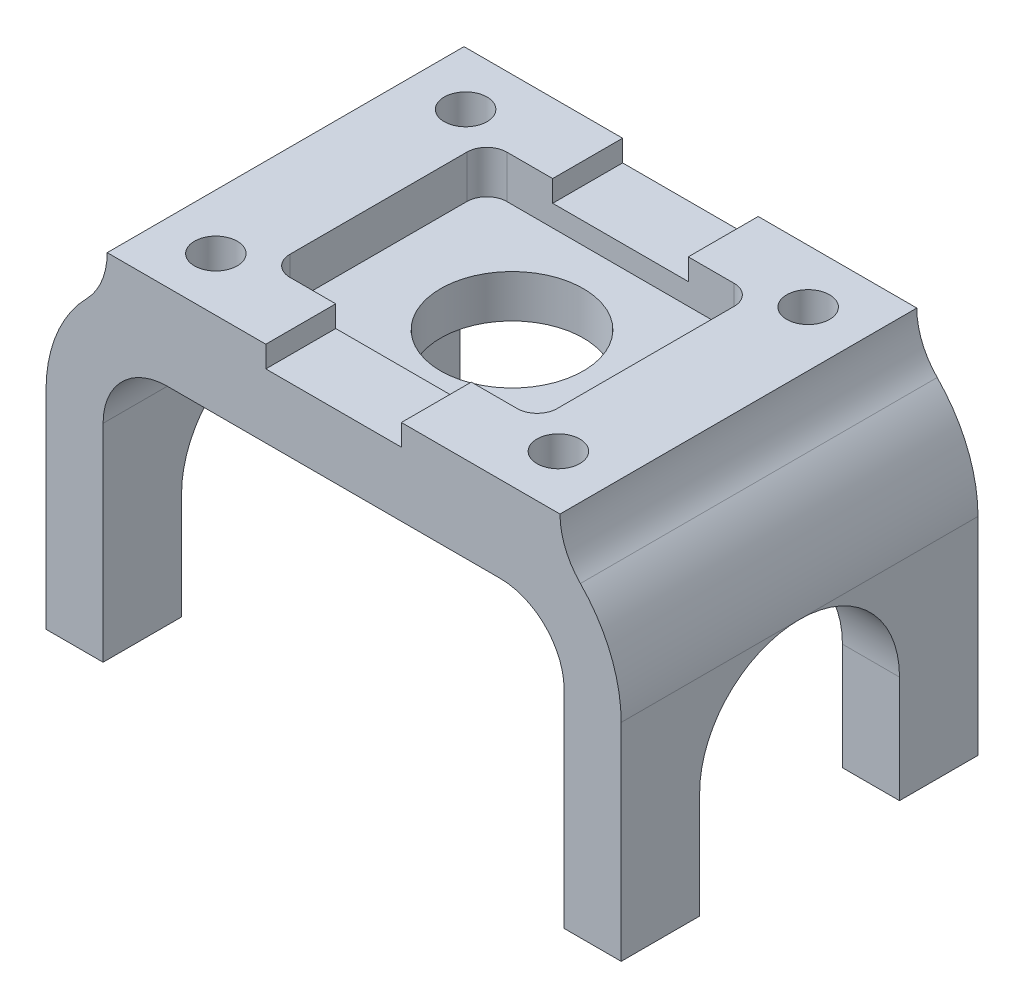
from build123d import *

# Parameters (mm, degrees)
BOSS_EXTRUDE1_DEPTH = 31.75
CUT_EXTRUDE1_DEPTH  = 118.537522281
CUT_EXTRUDE2_DEPTH  = 7.62
SKETCH5_W           = 24.13
SKETCH5_H           = 3.81
CUT_EXTRUDE3_DEPTH  = 95.766937067
CUT_EXTRUDE4_REACH  = 84.159
SKETCH6_R           = 12.7
CUT_EXTRUDE5_REACH  = 89.52
SKETCH7_R           = 3.81


with BuildPart() as part:
    # Sketch2 → Boss-Extrude1 (new, symmetric)
    with BuildSketch(Plane.XY):
        with BuildLine():
            Line((-29.591, 0), (29.591, 0))
            ThreePointArc((29.591, 0), (37.673230509, -3.347769491), (41.021, -11.43))
            Line((41.021, -11.43), (41.021, -48.26))
            Line((41.021, -48.26), (51.181, -48.26))
            Line((51.181, -48.26), (51.181, -11.43))
            ThreePointArc((51.181, -11.43), (49.29585059, -1.827302371), (43.920228208, 6.35))
            ThreePointArc((43.920228208, 6.35), (41.232417018, 10.438651186), (40.289842313, 15.24))
            Line((40.289842313, 15.24), (-40.289842313, 15.24))
            ThreePointArc((-40.289842313, 15.24), (-41.232417018, 10.438651186), (-43.920228208, 6.35))
            ThreePointArc((-43.920228208, 6.35), (-49.29585059, -1.827302371), (-51.181, -11.43))
            Line((-51.181, -11.43), (-51.181, -48.26))
            Line((-51.181, -48.26), (-41.021, -48.26))
            Line((-41.021, -48.26), (-41.021, -11.43))
            ThreePointArc((-41.021, -11.43), (-37.673230509, -3.347769491), (-29.591, 0))
        make_face()
    extrude(amount=BOSS_EXTRUDE1_DEPTH, both=True)

    # Sketch3 → Cut-Extrude1 (cut, through all)
    with BuildSketch(Plane(origin=(51.181, 0, 0), x_dir=(0, 0, -1), z_dir=(1, 0, 0))):
        with BuildLine():
            Line((-17.78, -48.26), (17.78, -48.26))
            Line((17.78, -48.26), (17.78, -29.21))
            ThreePointArc((17.78, -29.21), (0, -11.43), (-17.78, -29.21))
            Line((-17.78, -29.21), (-17.78, -48.26))
        make_face()
    extrude(amount=-CUT_EXTRUDE1_DEPTH, mode=Mode.SUBTRACT)

    # Sketch4 → Cut-Extrude2 (cut)
    with BuildSketch(Plane(origin=(0, 15.24, 0), x_dir=(1, 0, 0), z_dir=(0, 1, 0))):
        with BuildLine():
            Line((-20.223842313, 19.304), (20.223842313, 19.304))
            ThreePointArc((20.223842313, 19.304), (22.738314027, 18.262471714), (23.779842313, 15.748))
            Line((23.779842313, 15.748), (23.779842313, -15.748))
            ThreePointArc((23.779842313, -15.748), (22.738314027, -18.262471714), (20.223842313, -19.304))
            Line((20.223842313, -19.304), (-20.223842313, -19.304))
            ThreePointArc((-20.223842313, -19.304), (-22.738314027, -18.262471714), (-23.779842313, -15.748))
            Line((-23.779842313, -15.748), (-23.779842313, 15.748))
            ThreePointArc((-23.779842313, 15.748), (-22.738314027, 18.262471714), (-20.223842313, 19.304))
        make_face()
    extrude(amount=-CUT_EXTRUDE2_DEPTH, mode=Mode.SUBTRACT)

    # Sketch5 → Cut-Extrude3 (cut, through all)
    with BuildSketch(Plane.XY.offset(31.75)):
        with Locations((0, 13.335)):
            Rectangle(SKETCH5_W, SKETCH5_H)
    extrude(amount=-CUT_EXTRUDE3_DEPTH, mode=Mode.SUBTRACT)

    # Sketch6 → Cut-Extrude4 (cut, up to next)
    with BuildSketch(Plane(origin=(0, 7.62, 0), x_dir=(1, 0, 0), z_dir=(0, 1, 0)), mode=Mode.PRIVATE) as cut_extrude4_sk1:
        Circle(SKETCH6_R)
    cut_extrude4_tool1 = extrude(cut_extrude4_sk1.sketch, amount=-CUT_EXTRUDE4_REACH, mode=Mode.PRIVATE) & part.part
    add(cut_extrude4_tool1.solids().sort_by_distance((0, 7.62, 0))[0], mode=Mode.SUBTRACT)

    # Sketch7 → Cut-Extrude5 (cut, up to next)
    with BuildSketch(Plane(origin=(0, 15.24, 0), x_dir=(1, 0, 0), z_dir=(0, 1, 0)), mode=Mode.PRIVATE) as cut_extrude5_sk1:
        with Locations((-30.48, 22.225)):
            Circle(SKETCH7_R)
    cut_extrude5_tool1 = extrude(cut_extrude5_sk1.sketch, amount=-CUT_EXTRUDE5_REACH, mode=Mode.PRIVATE) & part.part
    # Sketch7 → Cut-Extrude5 (cut, up to next)
    with BuildSketch(Plane(origin=(0, 15.24, 0), x_dir=(1, 0, 0), z_dir=(0, 1, 0)), mode=Mode.PRIVATE) as cut_extrude5_sk2:
        with Locations((30.48, 22.225)):
            Circle(SKETCH7_R)
    cut_extrude5_tool2 = extrude(cut_extrude5_sk2.sketch, amount=-CUT_EXTRUDE5_REACH, mode=Mode.PRIVATE) & part.part
    # Sketch7 → Cut-Extrude5 (cut, up to next)
    with BuildSketch(Plane(origin=(0, 15.24, 0), x_dir=(1, 0, 0), z_dir=(0, 1, 0)), mode=Mode.PRIVATE) as cut_extrude5_sk3:
        with Locations((30.48, -22.225)):
            Circle(SKETCH7_R)
    cut_extrude5_tool3 = extrude(cut_extrude5_sk3.sketch, amount=-CUT_EXTRUDE5_REACH, mode=Mode.PRIVATE) & part.part
    # Sketch7 → Cut-Extrude5 (cut, up to next)
    with BuildSketch(Plane(origin=(0, 15.24, 0), x_dir=(1, 0, 0), z_dir=(0, 1, 0)), mode=Mode.PRIVATE) as cut_extrude5_sk4:
        with Locations((-30.48, -22.225)):
            Circle(SKETCH7_R)
    cut_extrude5_tool4 = extrude(cut_extrude5_sk4.sketch, amount=-CUT_EXTRUDE5_REACH, mode=Mode.PRIVATE) & part.part
    add(cut_extrude5_tool1.solids().sort_by_distance((-30.48, 15.24, -22.225))[0], mode=Mode.SUBTRACT)
    add(cut_extrude5_tool2.solids().sort_by_distance((30.48, 15.24, -22.225))[0], mode=Mode.SUBTRACT)
    add(cut_extrude5_tool3.solids().sort_by_distance((30.48, 15.24, 22.225))[0], mode=Mode.SUBTRACT)
    add(cut_extrude5_tool4.solids().sort_by_distance((-30.48, 15.24, 22.225))[0], mode=Mode.SUBTRACT)


solid = part.part
